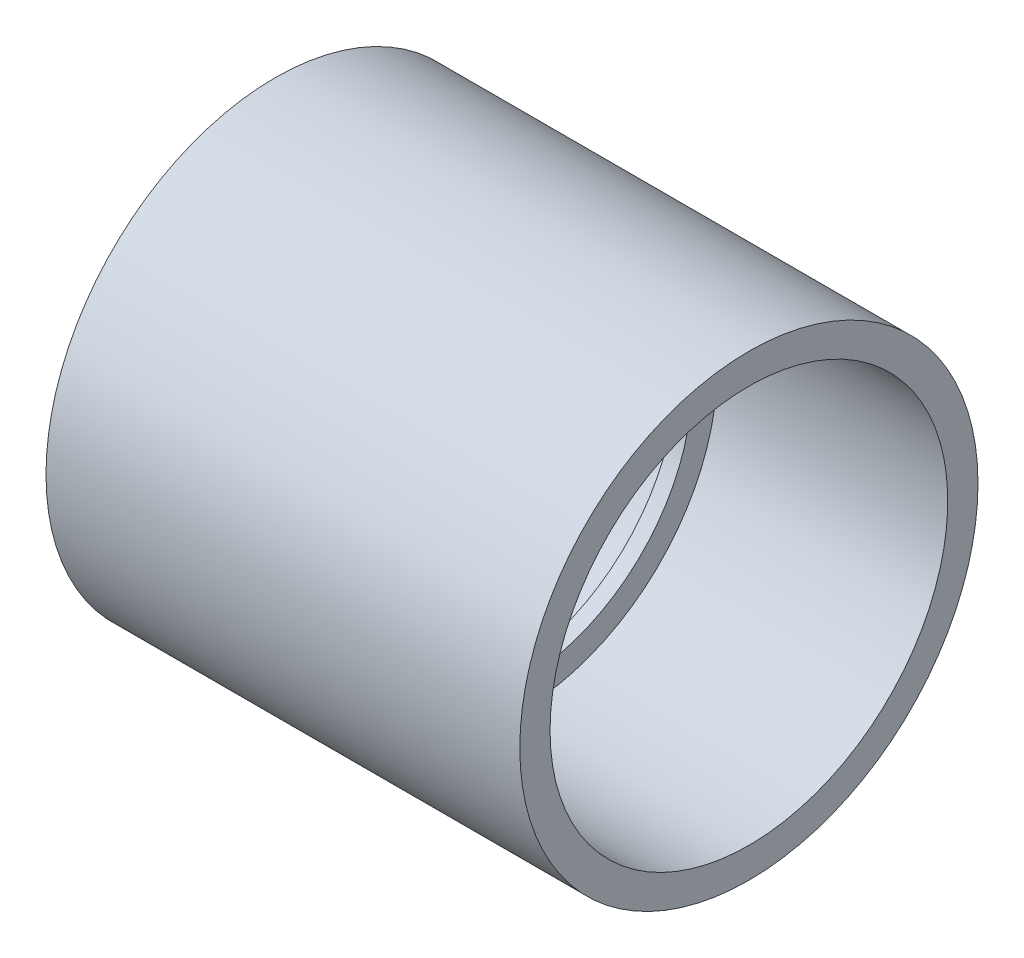
from build123d import *


with BuildPart() as part:
    # Sketch1 → Revolve1 (revolve)
    with BuildSketch(Plane.XY):
        Polygon((-36.115625, -34.925), (36.115625, -34.925), (36.115625, -30.3149), (1.190625, -30.0863), (1.190625, -26.2509), (-1.190625, -26.2509), (-1.190625, -30.0863), (-36.115625, -30.3149), align=None)
    revolve(axis=Axis((-36.115625, 0, 0), (1, 0, 0)))


solid = part.part
